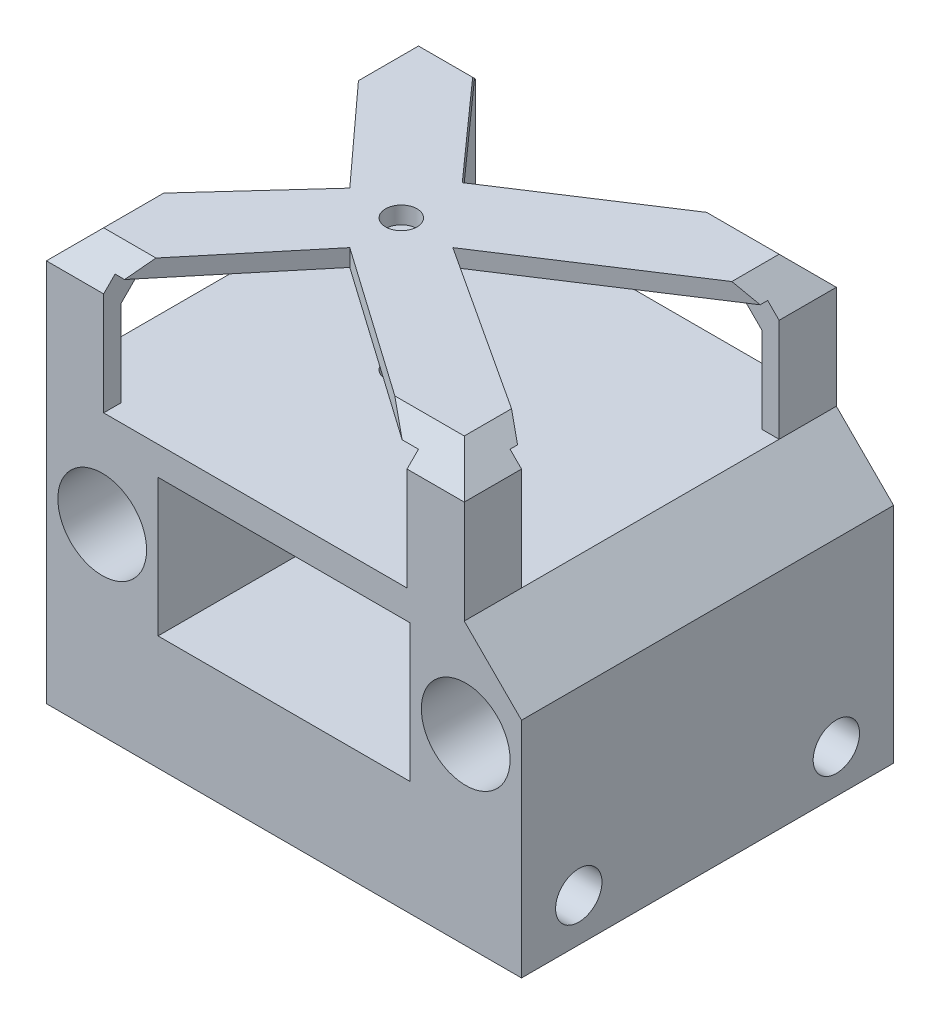
from build123d import *

# Parameters (mm, degrees)
SKETCH1_R           = 7.75
SKETCH1_W           = 44
SKETCH1_H           = 24
BOSS_EXTRUDE1_DEPTH = 65
SKETCH5_W           = 65
SKETCH5_H           = 15
SKETCH5_R           = 4.05
BOSS_EXTRUDE4_DEPTH = 83
CHAMFER1_SIZE       = 10
SKETCH6_R           = 2.75
CUT_EXTRUDE1_DEPTH  = 15
SKETCH8_R           = 2.75
BOSS_EXTRUDE5_DEPTH = 3
EXTRUDE_THIN2_DEPTH = 20
CHAMFER2_SIZE       = 5
CHAMFER3_SIZE       = 5


with BuildPart() as part:
    # Sketch1 → Boss-Extrude1 (new body)
    with BuildSketch(Plane.XY):
        Polygon((31.75, 17), (-31.75, 17), (-41.5, 17), (-41.5, -17), (-31.75, -17), (31.75, -17), (41.5, -17), (41.5, 17), align=None)
        with Locations((-31.75, 0)):
            Circle(SKETCH1_R, mode=Mode.SUBTRACT)
        with Locations((31.75, 0)):
            Circle(SKETCH1_R, mode=Mode.SUBTRACT)
        Rectangle(SKETCH1_W, SKETCH1_H, mode=Mode.SUBTRACT)
    extrude(amount=BOSS_EXTRUDE1_DEPTH)

    # Sketch5 → Boss-Extrude4 (add)
    with BuildSketch(Plane(origin=(41.5, 0, 0), x_dir=(0, 0, -1), z_dir=(1, 0, 0))):
        with Locations((-32.5, -24.5)):
            Rectangle(SKETCH5_W, SKETCH5_H)
        with Locations((-55, -24.5)):
            Circle(SKETCH5_R, mode=Mode.SUBTRACT)
        with Locations((-10, -24.5)):
            Circle(SKETCH5_R, mode=Mode.SUBTRACT)
    extrude(amount=-BOSS_EXTRUDE4_DEPTH)

    # Chamfer1
    chamfer1_edges = [part.edges().sort_by_distance(p)[0] for p in [
        (41.5, 17, 32.5),
    ]]
    chamfer(chamfer1_edges, length=CHAMFER1_SIZE)

    # Sketch6 → Cut-Extrude1 (cut)
    with BuildSketch(Plane(origin=(0, 12, 0), x_dir=(-1, 0, 0), z_dir=(0, -1, 0))):
        with Locations(Location((12, -32.5, 0), (0, 0, 90))):
            Circle(SKETCH6_R)
    extrude(amount=-CUT_EXTRUDE1_DEPTH, mode=Mode.SUBTRACT)



with BuildPart() as body_2:
    # Sketch8 → Boss-Extrude5 (new body)
    with BuildSketch(Plane(origin=(0, 37, 0), x_dir=(1, 0, 0), z_dir=(0, 1, 0))):
        Polygon((-41.5, -10), (-21, -32.5), (-41.5, -55), (-41.5, -65), (-31.5, -65), (-12, -41.5), (21.5, -65), (31.5, -65), (31.5, -55), (-3, -32.5), (31.5, -10), (31.5, 0), (21.5, 0), (-12, -21.847826087), (-31.5, 0), (-41.5, 0), align=None)
        with Locations(Location((-12, -32.5, 0), (0, 0, 90))):
            Circle(SKETCH8_R, mode=Mode.SUBTRACT)
    extrude(amount=BOSS_EXTRUDE5_DEPTH)


with BuildPart() as part_1:
    add(part.part)

    add(body_2.part)  # Extrude-Thin2 merges body 2
    # Sketch9 → Extrude-Thin2 (add)
    with BuildSketch(Plane(origin=(0, 37, 0), x_dir=(-1, 0, 0), z_dir=(0, -1, 0))):
        Polygon((41.5, -10), (41.5, 0), (31.5, 0), (31.5, -3), (38.5, -3), (38.5, -10), align=None)
        Polygon((-21.5, 0), (-31.5, 0), (-31.5, -10), (-28.5, -10), (-28.5, -3), (-21.5, -3), align=None)
    extrude_thin2 = extrude(amount=EXTRUDE_THIN2_DEPTH)

    # Mirror1: Extrude-Thin2 across plane
    add(extrude_thin2.mirror(Plane.XY.offset(32.5)))

    # Chamfer2
    chamfer2_edges = [part_1.edges().sort_by_distance(p)[0] for p in [
        (25, 37, 3),
        (28.5, 37, 6.5),
        (-38.5, 37, 58.5),
        (-35, 37, 62),
        (25, 37, 62),
        (28.5, 37, 58.5),
        (-38.5, 37, 6.5),
        (-35, 37, 3),
    ]]
    chamfer(chamfer2_edges, length=CHAMFER2_SIZE)

    # Chamfer3
    # the kernel refuses this chamfer: 5 mm, written as the material it takes off along each edge
    with BuildSketch(Plane(origin=(-41.5, 40, 42.14158506), x_dir=(0.9996219169112968, 0.0274958766105877, 0), z_dir=(0, 0, 1)), Plane(origin=(-54.35841494, 40, 65), x_dir=(0, 0.027495876610586317, -0.9996219169112968), z_dir=(1, 0, 0)), Plane(origin=(8.64158506, 40, 65), x_dir=(0, 0.027495876610586317, -0.9996219169112968), z_dir=(1, 0, 0)), Plane(origin=(31.5, 40, 77.85841494), x_dir=(-0.9996219169112968, 0.027495876610584936, 0), z_dir=(0, 0, -1)), Plane(origin=(44.35841494, 40, 0), x_dir=(0, 0.027495876610586317, 0.9996219169112968), z_dir=(-1, 0, 0)), Plane(origin=(-18.64158506, 40, 0), x_dir=(-1.1764219776297879e-15, 0.027495876610586317, 0.9996219169112968), z_dir=(-1, 0, 0)), Plane(origin=(-41.5, 40, -12.85841494), x_dir=(0.9996219169112968, 0.0274958766105877, 1.4205481831358163e-15), z_dir=(0, 0, 1))) as chamfer3_piece_1:
        Polygon((CHAMFER3_SIZE * 0.999621916911, -CHAMFER3_SIZE * 0.0274958766106), (-CHAMFER3_SIZE * 0.0274958766106, -CHAMFER3_SIZE * 0.999621916911), (0, 0), align=None)
    extrude(amount=35.71682988, mode=Mode.SUBTRACT)
    with BuildSketch(Plane(origin=(31.5, 40, 22.85841494), x_dir=(0.02749587661058701, -0.9996219169112968, 0), z_dir=(0, 0, -1))) as chamfer3_piece_2:
        Polygon((CHAMFER3_SIZE * 0.999621916911, CHAMFER3_SIZE * 0.0274958766106), (-CHAMFER3_SIZE * 0.0274958766106, CHAMFER3_SIZE * 0.999621916911), (0, 0), align=None)
    extrude(amount=35.71682988, mode=Mode.SUBTRACT)


solid = part_1.part
